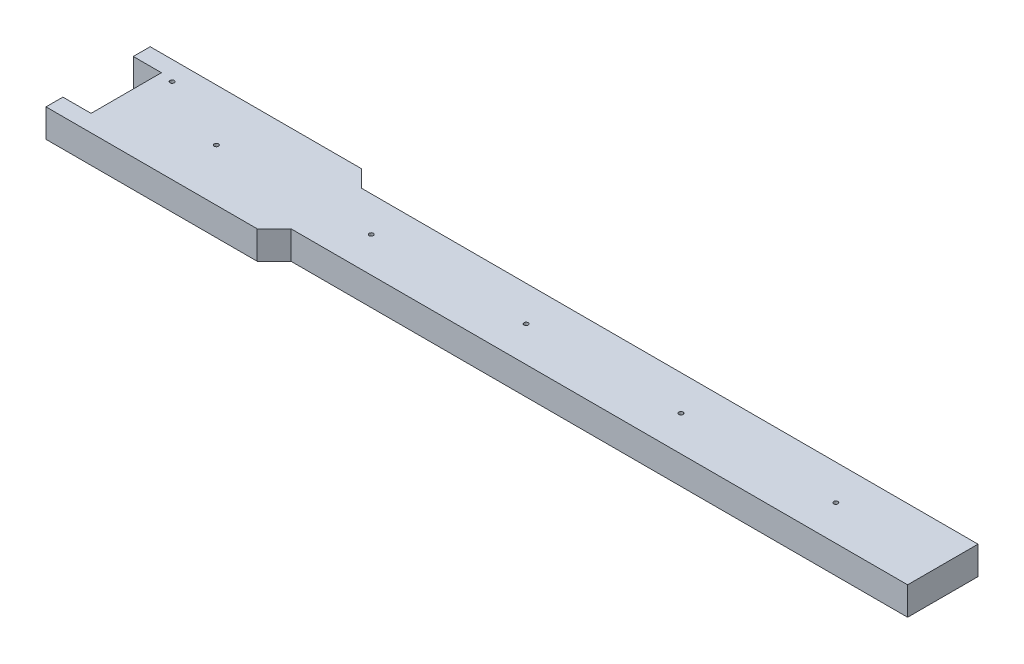
from build123d import *

# Parameters (mm, degrees)
EXTRUDE_1_DEPTH        = 10
SKETCH_2_R             = 0.75
CUT_EXTRUDE_1_DEPTH    = 302.763152157
PATTERN_LINEAR_1_COUNT = 5
PATTERN_LINEAR_1_PITCH = 55
OTHER_1_OUTLINE_R      = 0.75
OTHER_1_DEPTH          = 10


# Read off the part's stored shape, not the designer's step: Отверстие1
with BuildPart() as part:
    # Эскиз1 → Бобышка-Вытянуть1 (new body)
    with BuildSketch(Plane(origin=(0, 0, 0), x_dir=(1, 0, 0), z_dir=(0, 1, 0))):
        Polygon((0, 31), (75, 31), (81, 25), (300, 25), (300, 0), (81, 0), (75, -6), (0, -6), (0, 0), (10, 0), (10, 25), (0, 25), align=None)
    extrude(amount=EXTRUDE_1_DEPTH)

    # Эскиз2 → Вырез-Вытянуть1 (cut, through all)
    with BuildSketch(Plane(origin=(0, 10, 0), x_dir=(1, 0, 0), z_dir=(0, 1, 0))):
        with Locations(Location((42, 12.5, 0), (0, 0, 270))):
            Circle(SKETCH_2_R)
    cut_extrude_1 = extrude(amount=-CUT_EXTRUDE_1_DEPTH, mode=Mode.SUBTRACT)

    # Линейный массив1: Вырез-Вытянуть1 ×5
    with Locations(*[(i * PATTERN_LINEAR_1_PITCH, 0, 0) for i in range(1, PATTERN_LINEAR_1_COUNT)]):
        add(cut_extrude_1, mode=Mode.SUBTRACT)

    # Отверстие1 outline → Отверстие1 (cut)
    with BuildSketch(Plane(origin=(0, 0, 0), x_dir=(1, 0, 0), z_dir=(0, 1, 0))):
        with Locations((14.633333886, 24.136000106)):
            Circle(OTHER_1_OUTLINE_R)
    extrude(amount=OTHER_1_DEPTH, mode=Mode.SUBTRACT)


solid = part.part
